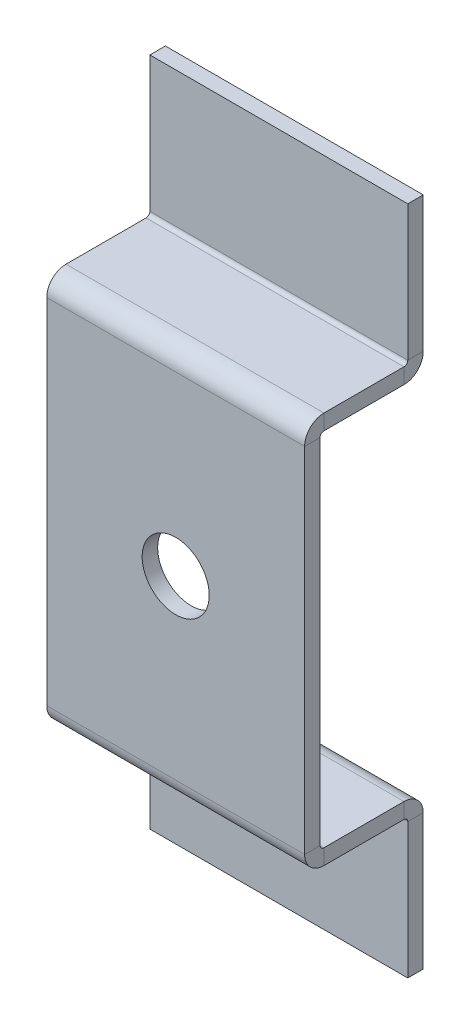
from build123d import *

# Parameters (mm, degrees)
SKETCH_1_W                         = 50
SKETCH_1_H                         = 70
SM_BASE_FLANGE_1_DEPTH             = 3
SM_EDGE_FLANGE_1_STRIP_W           = 13.4732
SM_EDGE_FLANGE_1_STRIP_H           = 3
SM_EDGE_FLANGE_1_STRIP_CUT_DEPTH   = 50
SM_EDGE_FLANGE_1_STRIP_2_W         = 13.4732
SM_EDGE_FLANGE_1_STRIP_2_H         = 3
SM_EDGE_FLANGE_1_STRIP_CUT_2_DEPTH = 50
SM_EDGE_FLANGE_1_DEPTH             = 50
SM_EDGE_FLANGE_1_BEND_DEPTH        = 50
SM_EDGE_FLANGE_2_STRIP_W           = 13.4732
SM_EDGE_FLANGE_2_STRIP_H           = 3
SM_EDGE_FLANGE_2_STRIP_CUT_DEPTH   = 50
SM_EDGE_FLANGE_2_STRIP_2_W         = 13.4732
SM_EDGE_FLANGE_2_STRIP_2_H         = 3
SM_EDGE_FLANGE_2_STRIP_CUT_2_DEPTH = 50
SM_EDGE_FLANGE_2_DEPTH             = 50
SM_EDGE_FLANGE_2_BEND_DEPTH        = 50
SKETCH_18_R                        = 6.5
CUT_EXTRUDE_1_DEPTH                = 115.144645078


# Sheet-metal steps are written as plain solids
with BuildPart() as part:
    # Sketch 1 → 基体-法兰1 (new body)
    with BuildSketch(Plane.XY):
        with Locations((25, 35)):
            Rectangle(SKETCH_1_W, SKETCH_1_H)
    extrude(amount=-SM_BASE_FLANGE_1_DEPTH)

    # 边线-法兰1 strip (across the edge) → 边线-法兰1 strip cut (cut)
    with BuildSketch(Plane(origin=(0, 70, -3), x_dir=(0, -1, 0), z_dir=(1, 0, 0))):
        with Locations((-6, -1.5)):
            Rectangle(SM_EDGE_FLANGE_1_STRIP_W, SM_EDGE_FLANGE_1_STRIP_H)
    extrude(amount=SM_EDGE_FLANGE_1_STRIP_CUT_DEPTH, mode=Mode.SUBTRACT)

    # 边线-法兰1 strip 2 (across the edge) → 边线-法兰1 strip cut 2 (cut)
    with BuildSketch(Plane(origin=(50, 0, -3), x_dir=(0, 1, 0), z_dir=(-1, 0, 0))):
        with Locations((-6, -1.5)):
            Rectangle(SM_EDGE_FLANGE_1_STRIP_2_W, SM_EDGE_FLANGE_1_STRIP_2_H)
    extrude(amount=SM_EDGE_FLANGE_1_STRIP_CUT_2_DEPTH, mode=Mode.SUBTRACT)

    # 边线-法兰1 section (across the edge) → 边线-法兰1 (add)
    with BuildSketch(Plane(origin=(0, 70, -3), x_dir=(0, -1, 0), z_dir=(1, 0, 0))):
        with BuildLine():
            Line((-3, 0.7366), (-3, 17))
            Line((-3, 17), (0, 17))
            Line((0, 17), (0, 0.7366))
            ThreePointArc((0, 0.7366), (0.215745145, 0.215745145), (0.7366, 0))
            Line((0.7366, 0), (0.7366, -3))
            ThreePointArc((0.7366, -3), (-1.905575199, -1.905575199), (-3, 0.7366))
        make_face()
    extrude(amount=SM_EDGE_FLANGE_1_DEPTH)

    # 边线-法兰1 section 2 (across the edge) → 边线-法兰1 bend (add)
    with BuildSketch(Plane(origin=(50, 0, -3), x_dir=(0, 1, 0), z_dir=(-1, 0, 0))):
        with BuildLine():
            Line((-3, 0.7366), (-3, 17))
            Line((-3, 17), (0, 17))
            Line((0, 17), (0, 0.7366))
            ThreePointArc((0, 0.7366), (0.215745145, 0.215745145), (0.7366, 0))
            Line((0.7366, 0), (0.7366, -3))
            ThreePointArc((0.7366, -3), (-1.905575199, -1.905575199), (-3, 0.7366))
        make_face()
    extrude(amount=SM_EDGE_FLANGE_1_BEND_DEPTH)

    # 边线-法兰2 strip (across the edge) → 边线-法兰2 strip cut (cut)
    with BuildSketch(Plane(origin=(0, -3, -20), x_dir=(0, 0, 1), z_dir=(1, 0, 0))):
        with Locations((-6, -1.5)):
            Rectangle(SM_EDGE_FLANGE_2_STRIP_W, SM_EDGE_FLANGE_2_STRIP_H)
    extrude(amount=SM_EDGE_FLANGE_2_STRIP_CUT_DEPTH, mode=Mode.SUBTRACT)

    # 边线-法兰2 strip 2 (across the edge) → 边线-法兰2 strip cut 2 (cut)
    with BuildSketch(Plane(origin=(50, 73, -20), x_dir=(0, 0, 1), z_dir=(-1, 0, 0))):
        with Locations((-6, -1.5)):
            Rectangle(SM_EDGE_FLANGE_2_STRIP_2_W, SM_EDGE_FLANGE_2_STRIP_2_H)
    extrude(amount=SM_EDGE_FLANGE_2_STRIP_CUT_2_DEPTH, mode=Mode.SUBTRACT)

    # 边线-法兰2 section (across the edge) → 边线-法兰2 (add)
    with BuildSketch(Plane(origin=(0, -3, -20), x_dir=(0, 0, 1), z_dir=(1, 0, 0))):
        with BuildLine():
            Line((-3, 0.7366), (-3, 27))
            Line((-3, 27), (0, 27))
            Line((0, 27), (0, 0.7366))
            ThreePointArc((0, 0.7366), (0.215745145, 0.215745145), (0.7366, 0))
            Line((0.7366, 0), (0.7366, -3))
            ThreePointArc((0.7366, -3), (-1.905575199, -1.905575199), (-3, 0.7366))
        make_face()
    extrude(amount=SM_EDGE_FLANGE_2_DEPTH)

    # 边线-法兰2 section 2 (across the edge) → 边线-法兰2 bend (add)
    with BuildSketch(Plane(origin=(50, 73, -20), x_dir=(0, 0, 1), z_dir=(-1, 0, 0))):
        with BuildLine():
            Line((-3, 0.7366), (-3, 27))
            Line((-3, 27), (0, 27))
            Line((0, 27), (0, 0.7366))
            ThreePointArc((0, 0.7366), (0.215745145, 0.215745145), (0.7366, 0))
            Line((0.7366, 0), (0.7366, -3))
            ThreePointArc((0.7366, -3), (-1.905575199, -1.905575199), (-3, 0.7366))
        make_face()
    extrude(amount=SM_EDGE_FLANGE_2_BEND_DEPTH)

    # 草图18 → 切除-拉伸1 (cut, through all)
    with BuildSketch(Plane.XY):
        with Locations((25, 35)):
            Circle(SKETCH_18_R)
    extrude(amount=-CUT_EXTRUDE_1_DEPTH, mode=Mode.SUBTRACT)


solid = part.part
